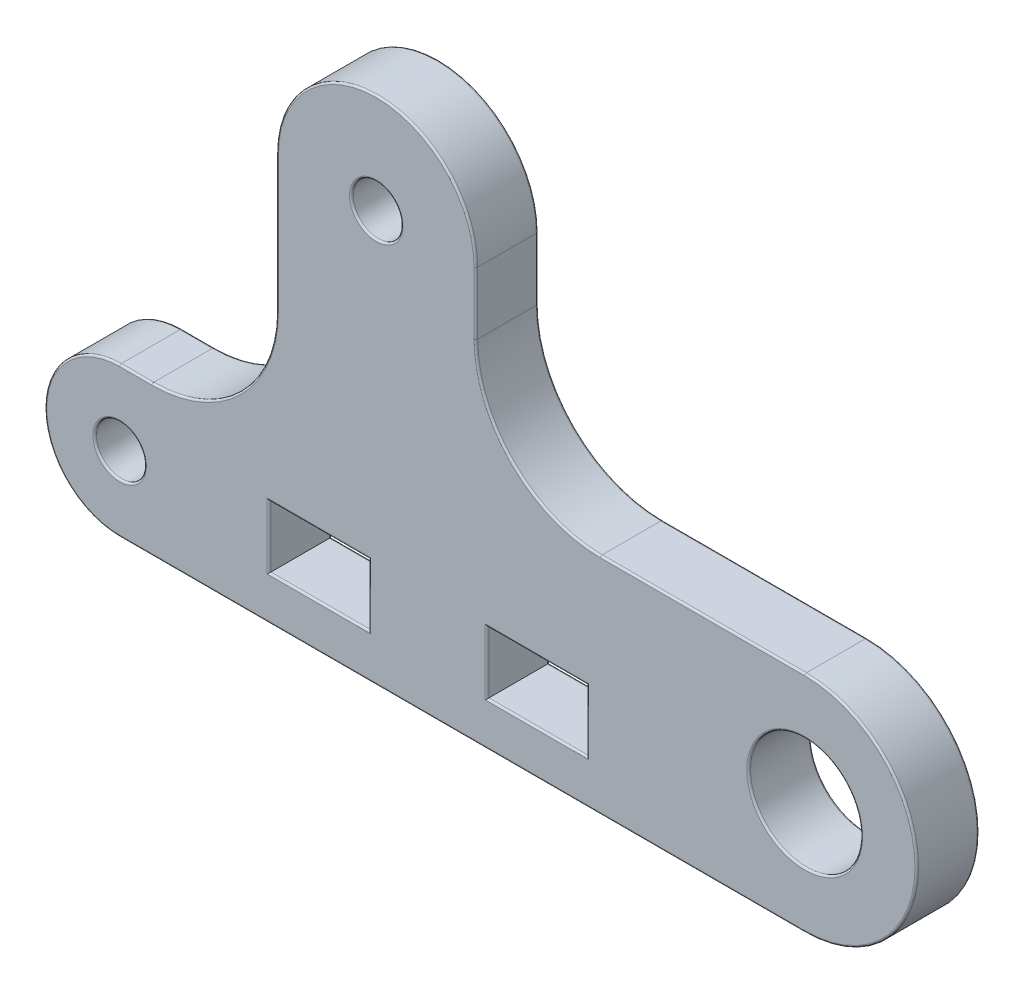
from build123d import *

# Parameters (mm, degrees)
SZKIC1_R                    = 2
SZKIC1_R_2                  = 4.5
SZKIC1_W                    = 8
SZKIC1_H                    = 5
DODANIE_WYCI_GNI_CIE1_DEPTH = 2.5
ZAOKR_GLENIE1_R             = 0.15


with BuildPart() as part:
    # Szkic1 → Dodanie-wyciągnięcie1 (new, symmetric)
    with BuildSketch(Plane.XY):
        with BuildLine():
            Line((-27.5, 0), (27.5, 0))
            ThreePointArc((27.5, 0), (36.5, 9), (27.5, 18))
            Line((27.5, 18), (11.1, 18))
            ThreePointArc((11.1, 18), (4.028932188, 20.928932188), (1.1, 28))
            Line((1.1, 28), (1.1, 33))
            ThreePointArc((1.1, 33), (-6.9, 41), (-14.9, 33))
            Line((-14.9, 33), (-14.9, 22))
            ThreePointArc((-14.9, 22), (-17.828932188, 14.928932188), (-24.9, 12))
            Line((-24.9, 12), (-27.5, 12))
            ThreePointArc((-27.5, 12), (-33.5, 6), (-27.5, 0))
        make_face()
        with Locations((-27.5, 6)):
            Circle(SZKIC1_R, mode=Mode.SUBTRACT)
        with Locations((27.5, 9)):
            Circle(SZKIC1_R_2, mode=Mode.SUBTRACT)
        with Locations((-6.9, 33)):
            Circle(SZKIC1_R, mode=Mode.SUBTRACT)
        with Locations((-11.5, 6)):
            Rectangle(SZKIC1_W, SZKIC1_H, mode=Mode.SUBTRACT)
        with Locations((6, 6)):
            Rectangle(SZKIC1_W, SZKIC1_H, mode=Mode.SUBTRACT)
    extrude(amount=DODANIE_WYCI_GNI_CIE1_DEPTH, both=True)

    # Zaokrąglenie1
    zaokr_glenie1_edges = [part.edges().sort_by_distance(p)[0] for p in [
        (10, 6, -2.5),
        (6, 3.5, -2.5),
        (2, 6, -2.5),
        (6, 8.5, -2.5),
        (-7.5, 6, -2.5),
        (-11.5, 3.5, -2.5),
        (-15.5, 6, -2.5),
        (-11.5, 8.5, -2.5),
        (-8.9, 33, -2.5),
        (23, 9, -2.5),
        (0, 0, -2.5),
        (36.5, 9, -2.5),
        (19.3, 18, -2.5),
        (4.028932188, 20.928932188, -2.5),
        (1.1, 30.5, -2.5),
        (-6.9, 41, -2.5),
        (-14.9, 27.5, -2.5),
        (-17.828932188, 14.928932188, -2.5),
        (-26.2, 12, -2.5),
        (-33.5, 6, -2.5),
        (-29.5, 6, -2.5),
        (6, 3.5, 2.5),
        (10, 6, 2.5),
        (6, 8.5, 2.5),
        (2, 6, 2.5),
        (-8.9, 33, 2.5),
        (-29.5, 6, 2.5),
        (23, 9, 2.5),
        (-26.2, 12, 2.5),
        (-17.828932188, 14.928932188, 2.5),
        (-14.9, 27.5, 2.5),
        (-6.9, 41, 2.5),
        (1.1, 30.5, 2.5),
        (4.028932188, 20.928932188, 2.5),
        (19.3, 18, 2.5),
        (36.5, 9, 2.5),
        (0, 0, 2.5),
        (-33.5, 6, 2.5),
        (-11.5, 3.5, 2.5),
        (-7.5, 6, 2.5),
        (-11.5, 8.5, 2.5),
        (-15.5, 6, 2.5),
    ]]
    fillet(zaokr_glenie1_edges, radius=ZAOKR_GLENIE1_R)


solid = part.part
